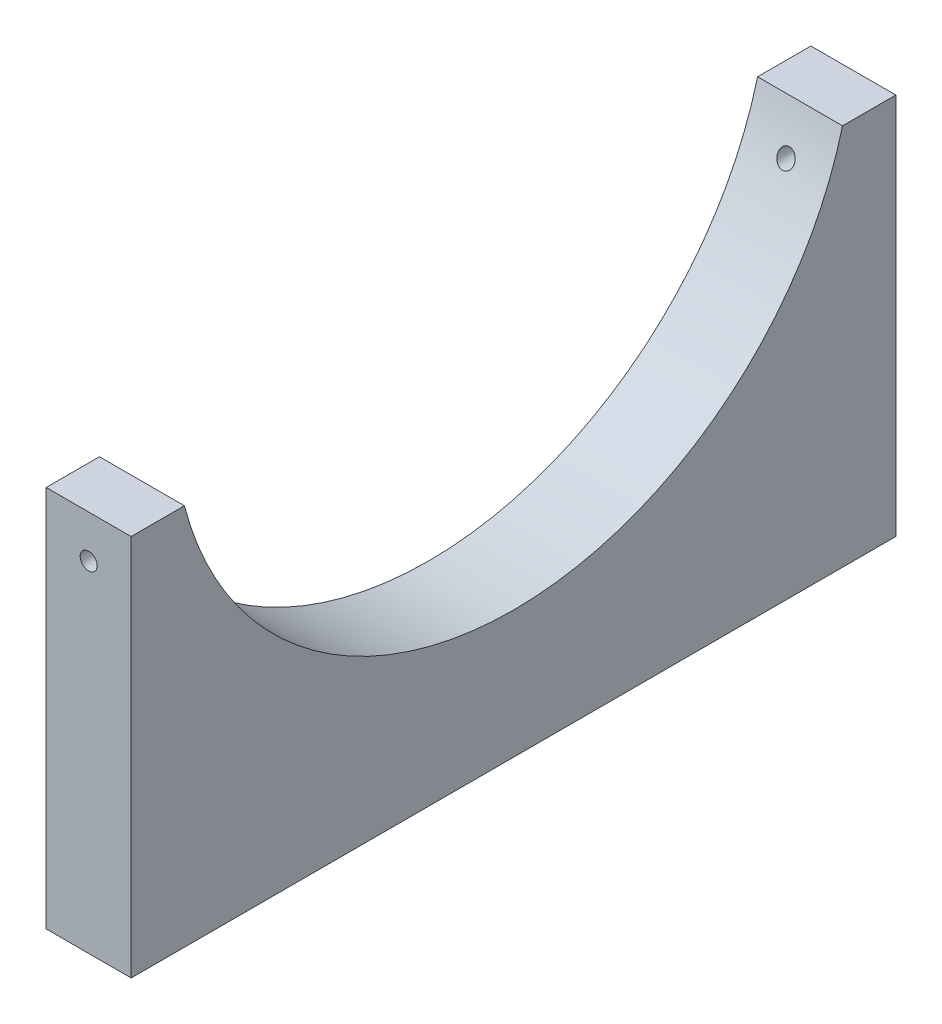
from build123d import *

# Parameters (mm, degrees)
SKETCH1_W               = 189.5
SKETCH1_H               = 90
BOSS_EXTRUDE1_DEPTH     = 80
SKETCH3_R               = 8.15
CUT_EXTRUDE2_DEPTH      = 40
SKETCH4_R               = 10.3
CUT_EXTRUDE3_DEPTH      = 40
CUT_EXTRUDE1_DEPTH      = 213.601299385
CUT_EXTRUDE5_START      = -10
SKETCH5_R               = 83.637561864
CUT_EXTRUDE5_DEPTH      = 193.050272352
SKETCH6_R               = 2
CUT_EXTRUDE6_DEPTH      = 15
CUT_EXTRUDE7_DEPTH      = 122.674992168
CUT_EXTRUDE7_DEPTH_BACK = 122.674992168
SKETCH7_R               = 1


with BuildPart() as part:
    # Sketch1 → Boss-Extrude1 (new body)
    with BuildSketch(Plane(origin=(0, 0, 0), x_dir=(1, 0, 0), z_dir=(0, 1, 0))):
        with Locations((26.340909091, 8.75)):
            Rectangle(SKETCH1_W, SKETCH1_H)
    extrude(amount=BOSS_EXTRUDE1_DEPTH)

    # Sketch3 → Cut-Extrude2 (cut)
    with BuildSketch(Plane.XY.offset(36.25)):
        with Locations((-6.709090909, 45)):
            Circle(SKETCH3_R)
        with Locations((44.290909091, 45)):
            Circle(SKETCH3_R)
        with Locations((95.290909091, 45)):
            Circle(SKETCH3_R)
    extrude(amount=-CUT_EXTRUDE2_DEPTH, mode=Mode.SUBTRACT)

    # Sketch4 → Cut-Extrude3 (cut)
    with BuildSketch(Plane(origin=(0, 0, -53.75), x_dir=(-1, 0, 0), z_dir=(0, 0, -1))):
        with Locations((-18.790909091, 45)):
            Circle(SKETCH4_R)
    extrude(amount=-CUT_EXTRUDE3_DEPTH, mode=Mode.SUBTRACT)

    # Sketch2 → Cut-Extrude1 (cut, through all)
    with BuildSketch(Plane.ZY.offset(68.409090909)):
        with BuildLine():
            Line((-53.75, 80), (-53.75, 45))
            Line((-53.75, 45), (-47.479833462, 45))
            ThreePointArc((-47.479833462, 45), (-8.75, 15), (29.979833462, 45))
            Line((29.979833462, 45), (36.25, 45))
            Line((36.25, 45), (36.25, 80))
            Line((36.25, 80), (-53.75, 80))
        make_face()
    extrude(amount=-CUT_EXTRUDE1_DEPTH, mode=Mode.SUBTRACT)

    # Sketch5 → Cut-Extrude5 (cut, through all)
    with BuildSketch(Plane.ZY.offset(68.409090909).offset(CUT_EXTRUDE5_START)):
        with Locations((-14.4166378, 36.2788863)):
            Circle(SKETCH5_R)
    extrude(amount=-CUT_EXTRUDE5_DEPTH, mode=Mode.SUBTRACT)

    # Sketch6 → Cut-Extrude6 (cut)
    with BuildSketch(Plane.XZ):
        with Locations((-63.409090909, 21.25)):
            Circle(SKETCH6_R)
        with Locations((-63.409090909, -38.75)):
            Circle(SKETCH6_R)
    extrude(amount=-CUT_EXTRUDE6_DEPTH, mode=Mode.SUBTRACT)

    # Sketch7 → Cut-Extrude7 (cut, two sides: drawn at the far end of the back side and taken through both)
    with BuildSketch(Plane.XY.offset(36.25).offset(-CUT_EXTRUDE7_DEPTH_BACK)):
        with Locations((-63.409090909, 40)):
            Circle(SKETCH7_R)
    extrude(amount=CUT_EXTRUDE7_DEPTH + CUT_EXTRUDE7_DEPTH_BACK, mode=Mode.SUBTRACT)


solid = part.part
